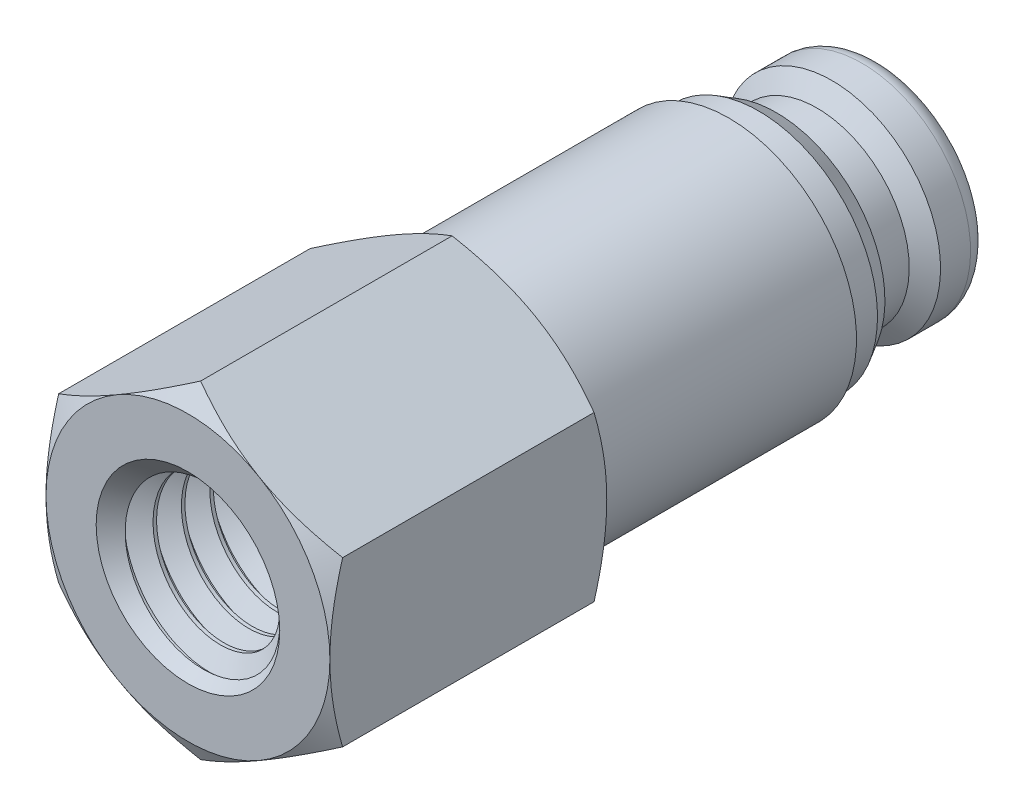
from build123d import *

# Parameters (mm, degrees)
EXTRUDE1_DEPTH               = 7.8
SKETCH2_R                    = 2.5
CUT_EXTRUDE1_DEPTH           = 6.5
SWEEP1_PITCH                 = 0.8
SKETCH5_R                    = 2.58660254
CUT_EXTRUDE2_OTHER_WAY_DEPTH = 10.908245811
CUT_EXTRUDE2_OTHER_WAY_TAPER = -45
SKETCH6_OUTSIDE_W            = 50.686
SKETCH6_OUTSIDE_H            = 51.924
SKETCH6_OUTSIDE_R            = 4
CUT_EXTRUDE3_DEPTH           = 10.908245724
CUT_EXTRUDE3_DRAFT           = -60
SKETCH8_R                    = 1.492
CUT_EXTRUDE4_DEPTH           = 13
SKETCH9_OUTSIDE_W            = 63.79
SKETCH9_OUTSIDE_H            = 65.028
SKETCH9_OUTSIDE_R            = 4
CUT_EXTRUDE5_DEPTH           = 14.199368672
CUT_EXTRUDE5_TAPER           = 60
CUT_EXTRUDE5_OTHER_WAY_DEPTH = 14.199368672
CUT_EXTRUDE5_OTHER_WAY_TAPER = 60


with BuildPart() as part:
    # Sketch1 → Extrude1 (new body)
    with BuildSketch(Plane.XY):
        Polygon((0, 4.618802154), (-4, 2.309401077), (-4, -2.309401077), (0, -4.618802154), (4, -2.309401077), (4, 2.309401077), align=None)
    extrude(amount=-EXTRUDE1_DEPTH)

    # Sketch2 → Cut-Extrude1 (cut)
    with BuildSketch(Plane.XY):
        Circle(SKETCH2_R)
    extrude(amount=-CUT_EXTRUDE1_DEPTH, mode=Mode.SUBTRACT)

    # Sweep1: the profile of Sketch4 screwed along a right-hand helix of 9.125 turns, 6 arcs to a turn; built about Z, then put on its axis
    sweep1_z = Axis((0, 0, 0), (0, 0, 1))
    sweep1_corners = [(1.980384758, 0, -0.4), (1.980384758, 0, -0.3), (2.54330127, 0, 0.025), (2.54330127, 0, -0.725)]
    with BuildLine(mode=Mode.PRIVATE) as sweep1_profile:
        Line(sweep1_corners[0], sweep1_corners[1])
        Line(sweep1_corners[1], sweep1_corners[2])
        Line(sweep1_corners[2], sweep1_corners[3])
        Line(sweep1_corners[3], sweep1_corners[0])
    sweep1_cap = Face(sweep1_profile.wire())
    sweep1_turn_angles = [0, 30, 60, 90, 120, 150, 180, 210, 240, 270, 300, 330, 360]
    sweep1_turn_weights = [1, 0.8660254037844387, 1, 0.8660254037844387, 1, 0.8660254037844387, 1, 0.8660254037844387, 1, 0.8660254037844387, 1, 0.8660254037844387, 1]
    sweep1_turn_rails = [Edge.make_bspline([Vector(p[0], p[1], 0).rotate(sweep1_z, sweep1_turn_angles[k]) / sweep1_turn_weights[k] + Vector(0, 0, p[2] + SWEEP1_PITCH * sweep1_turn_angles[k] / 360) for k in range(13)], [0, 0, 0, 1, 1, 2, 2, 3, 3, 4, 4, 5, 5, 6, 6, 6], 2, sweep1_turn_weights) for p in sweep1_corners]
    sweep1_turn_sides = [Face.make_surface_from_curves(sweep1_turn_rails[p[0]], sweep1_turn_rails[p[1]]) for p in [(0, 1), (1, 2), (2, 3), (3, 0)]]
    sweep1_last_angles = [3240, 3262.5, 3285]
    sweep1_last_weights = [1, 0.9238795325112336, 1]
    sweep1_last_rails = [Edge.make_bspline([Vector(p[0], p[1], 0).rotate(sweep1_z, sweep1_last_angles[k]) / sweep1_last_weights[k] + Vector(0, 0, p[2] + SWEEP1_PITCH * sweep1_last_angles[k] / 360) for k in range(3)], [0, 0, 0, 1, 1, 1], 2, sweep1_last_weights) for p in sweep1_corners]
    sweep1_last_sides = [Face.make_surface_from_curves(sweep1_last_rails[p[0]], sweep1_last_rails[p[1]]) for p in [(0, 1), (1, 2), (2, 3), (3, 0)]]
    sweep1 = Plane(origin=(0, 0, 0), x_dir=(0, 1, 0), z_dir=(0, 0, -1)) * Solid(Shell([*[p.moved(Location((0, 0, SWEEP1_PITCH * i))) for i in range(9) for p in sweep1_turn_sides], *sweep1_last_sides, sweep1_cap, sweep1_cap.rotate(sweep1_z, 3285).moved(Location((0, 0, SWEEP1_PITCH * 3285 / 360)))]))
    add(sweep1)

    # Cut-Extrude2 cone 1 section (through the dimple's axis) → Cut-Extrude2 (revolve, cut)
    with BuildSketch(Plane(origin=(0, 0, 0), x_dir=(0, -1, 0), z_dir=(1, 0, 0))):
        Polygon((0, 0), (2.58660254, 0), (0, 2.58660254), align=None)
    revolve(axis=Axis((0, 0, 0), (0, 0, -1)), mode=Mode.SUBTRACT)

    # Sketch5 → Cut-Extrude2 other way (cut)
    with BuildSketch(Plane.XY):
        Circle(SKETCH5_R)
    extrude(amount=CUT_EXTRUDE2_OTHER_WAY_DEPTH, taper=CUT_EXTRUDE2_OTHER_WAY_TAPER, mode=Mode.SUBTRACT)


with BuildPart() as cut_extrude3_tool:
    # Sketch6 outside → Cut-Extrude3 (with draft: the straight prism first)
    with BuildSketch(Plane.XY):
        Rectangle(SKETCH6_OUTSIDE_W, SKETCH6_OUTSIDE_H)
        Circle(SKETCH6_OUTSIDE_R, mode=Mode.SUBTRACT)
    extrude(amount=-CUT_EXTRUDE3_DEPTH)
    # Cut-Extrude3: the draft: its side faces are tilted about the plane it starts from
    cut_extrude3_sides = [cut_extrude3_tool.faces().sort_by_distance(p)[0] for p in [
        (0, -25.962, -5.454122862),
        (25.343, 0, -5.454122862),
        (0, 25.962, -5.454122862),
        (-25.343, 0, -5.454122862),
        (-4, 0, -5.454122862),
    ]]
    draft(cut_extrude3_sides, Plane.XY, CUT_EXTRUDE3_DRAFT)


with BuildPart() as part_1:
    add(part.part)

    # Cut-Extrude3: cut by cut_extrude3_tool
    add(cut_extrude3_tool.part, mode=Mode.SUBTRACT)

    # Sketch7 → Revolve1 (revolve)
    with BuildSketch(Plane(origin=(0, 0, 0), x_dir=(0, 0, -1), z_dir=(1, 0, 0)), mode=Mode.PRIVATE) as revolve1_sk:
        with BuildLine():
            Line((7.8, 3.6), (15.236966802, 3.6))
            Line((15.236966802, 3.6), (15.236966802, 3.346))
            Line((15.236966802, 3.346), (16.083633469, 3.346))
            Line((16.083633469, 3.346), (16.579, 3.06))
            Line((16.579, 3.06), (16.579, 2.601))
            Line((16.579, 2.601), (17.722, 2.601))
            Line((17.722, 2.601), (17.722, 2.326765158))
            Line((17.722, 2.326765158), (18.145333333, 3.06))
            Line((18.145333333, 3.06), (18.992, 3.06))
            ThreePointArc((18.992, 3.06), (19.351210245, 2.911210245), (19.5, 2.552))
            Line((19.5, 2.552), (19.5, 2.381))
            Line((19.5, 2.381), (19.119, 2))
            Line((19.119, 2), (7.8, 2))
            Line((7.8, 2), (7.8, 3.6))
        make_face()
    revolve(revolve1_sk.sketch.rotate(Axis((0, 0, 0), (0, 0, -1)), 180), axis=Axis((0, 0, 0), (0, 0, -1)))

    # Sketch8 → Cut-Extrude4 (cut)
    with BuildSketch(Plane(origin=(0, 0, -19.5), x_dir=(-1, 0, 0), z_dir=(0, 0, -1))):
        with Locations(Location((0, 0, 0), (0, 0, 180))):
            Circle(SKETCH8_R)
    extrude(amount=-CUT_EXTRUDE4_DEPTH, mode=Mode.SUBTRACT)

    # Sketch9 outside → Cut-Extrude5 (cut)
    with BuildSketch(Plane(origin=(0, 0, -7.8), x_dir=(-1, 0, 0), z_dir=(0, 0, -1))):
        Rectangle(SKETCH9_OUTSIDE_W, SKETCH9_OUTSIDE_H)
        Circle(SKETCH9_OUTSIDE_R, mode=Mode.SUBTRACT)
    extrude(amount=-CUT_EXTRUDE5_DEPTH, taper=CUT_EXTRUDE5_TAPER, mode=Mode.SUBTRACT)

    # Sketch9 outside → Cut-Extrude5 other way (cut)
    with BuildSketch(Plane(origin=(0, 0, -7.8), x_dir=(-1, 0, 0), z_dir=(0, 0, -1))):
        Rectangle(SKETCH9_OUTSIDE_W, SKETCH9_OUTSIDE_H)
        Circle(SKETCH9_OUTSIDE_R, mode=Mode.SUBTRACT)
    extrude(amount=CUT_EXTRUDE5_OTHER_WAY_DEPTH, taper=CUT_EXTRUDE5_OTHER_WAY_TAPER, mode=Mode.SUBTRACT)


solid = part_1.part
